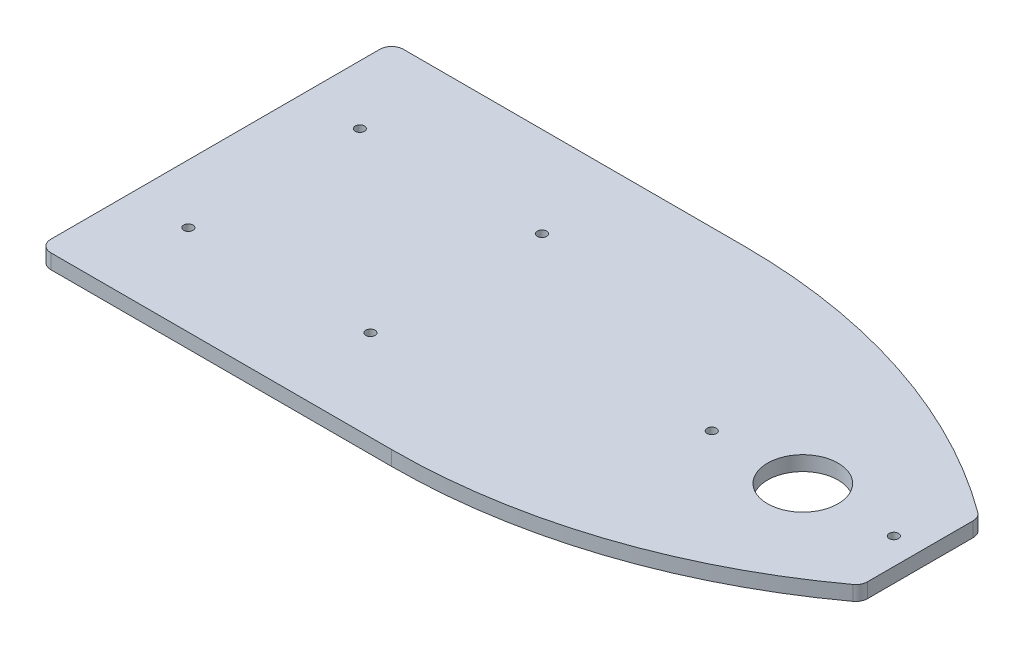
from build123d import *

# Parameters (mm, degrees)
SKETCH1_W           = 152.4
SKETCH1_H           = 76.2
BOSS_EXTRUDE1_DEPTH = 3.175
CUT_EXTRUDE1_DEPTH  = 3.175
FILLET2_R           = 2.54
FILLET3_R           = 2.54
SKETCH5_R           = 7.62
CUT_EXTRUDE2_DEPTH  = 3.175
SKETCH7_R           = 1.0033
CUT_EXTRUDE4_DEPTH  = 86.253332046
SKETCH6_R           = 1.0033
CUT_EXTRUDE5_DEPTH  = 86.253332046


with BuildPart() as part:
    # Sketch1 → Boss-Extrude1 (new body)
    with BuildSketch(Plane(origin=(0, 0, 0), x_dir=(1, 0, 0), z_dir=(0, 1, 0))):
        Rectangle(SKETCH1_W, SKETCH1_H)
    extrude(amount=BOSS_EXTRUDE1_DEPTH)

    # Sketch4 → Cut-Extrude1 (cut)
    with BuildSketch(Plane(origin=(0, 3.175, 0), x_dir=(1, 0, 0), z_dir=(0, 1, 0))):
        with BuildLine():
            Line((0, 38.1), (76.2, 38.1))
            Line((76.2, 38.1), (76.2, 12.7))
            ThreePointArc((76.2, 12.7), (40.160926284, 31.582778852), (0, 38.1))
        make_face()
        with BuildLine():
            Line((76.2, -38.1), (76.2, -12.7))
            ThreePointArc((76.2, -12.7), (40.160926284, -31.582778852), (0, -38.1))
            Line((0, -38.1), (76.2, -38.1))
        make_face()
    extrude(amount=-CUT_EXTRUDE1_DEPTH, mode=Mode.SUBTRACT)

    # Fillet2
    fillet2_edges = [part.edges().sort_by_distance(p)[0] for p in [
        (76.2, 1.5875, 12.7),
        (76.2, 1.5875, -12.7),
    ]]
    fillet(fillet2_edges, radius=FILLET2_R)

    # Fillet3
    fillet3_edges = [part.edges().sort_by_distance(p)[0] for p in [
        (-76.2, 1.5875, 38.1),
        (-76.2, 1.5875, -38.1),
    ]]
    fillet(fillet3_edges, radius=FILLET3_R)

    # Sketch5 → Cut-Extrude2 (cut)
    with BuildSketch(Plane(origin=(0, 3.175, 0), x_dir=(1, 0, 0), z_dir=(0, 1, 0))):
        with Locations((50.8, 0)):
            Circle(SKETCH5_R)
    extrude(amount=-CUT_EXTRUDE2_DEPTH, mode=Mode.SUBTRACT)

    # Sketch7 → Cut-Extrude4 (cut, through all)
    with BuildSketch(Plane(origin=(0, 3.175, 0), x_dir=(1, 0, 0), z_dir=(0, 1, 0))):
        with Locations((70.485, 0)):
            Circle(SKETCH7_R)
        with Locations((31.115, 0)):
            Circle(SKETCH7_R)
    extrude(amount=-CUT_EXTRUDE4_DEPTH, mode=Mode.SUBTRACT)

    # Sketch6 → Cut-Extrude5 (cut, through all)
    with BuildSketch(Plane(origin=(0, 3.175, 0), x_dir=(1, 0, 0), z_dir=(0, 1, 0))):
        with Locations((-63.5, -18.542)):
            Circle(SKETCH6_R)
        with Locations((-63.5, 18.542)):
            Circle(SKETCH6_R)
        with Locations((-24.13, -18.542)):
            Circle(SKETCH6_R)
        with Locations((-24.13, 18.542)):
            Circle(SKETCH6_R)
    extrude(amount=-CUT_EXTRUDE5_DEPTH, mode=Mode.SUBTRACT)


solid = part.part
